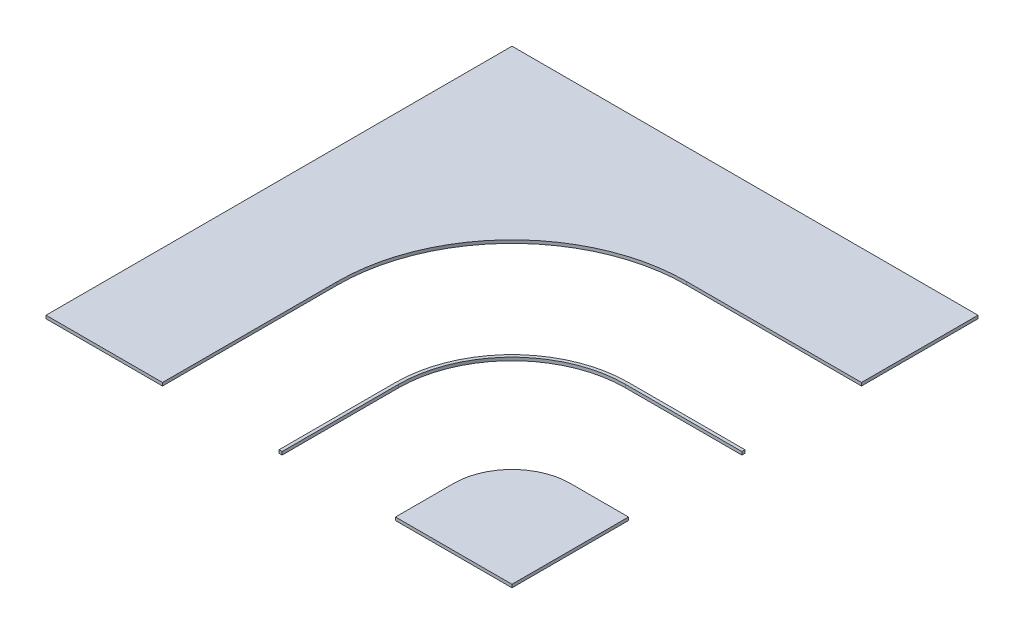
from build123d import *

# Parameters (mm, degrees)
BOSS_EXTRUDE1_DEPTH   = 10
BOSS_EXTRUDE1_2_DEPTH = 10
EXTRUDE_THIN1_DEPTH   = 10


with BuildPart() as part:
    # Sketch1 → Boss-Extrude1 (new body)
    with BuildSketch(Plane(origin=(0, 0, 0), x_dir=(1, 0, 0), z_dir=(0, 1, 0))):
        with BuildLine():
            Line((-750, 750), (-750, -750))
            Line((-750, -750), (-375.000000001, -750))
            Line((-375.000000001, -750), (-375.000000001, -187.5))
            ThreePointArc((-375.000000001, -187.5), (-210.247564418, 210.247564417), (187.5, 375))
            Line((187.5, 375), (375, 375))
            Line((375, 375.000000001), (379.917780163, 375.000000001))
            Line((379.917780163, 375), (750, 375))
            Line((750, 375), (750, 750))
            Line((750, 750), (-750, 750))
        make_face()
    extrude(amount=BOSS_EXTRUDE1_DEPTH)


with BuildPart() as body_2:
    # Sketch1 → Boss-Extrude1 2 (new body)
    with BuildSketch(Plane(origin=(0, 0, 0), x_dir=(1, 0, 0), z_dir=(0, 1, 0))):
        with BuildLine():
            Line((374.999999999, -562.5), (374.999999999, -750))
            Line((374.999999999, -750), (750, -750))
            Line((750, -750), (750, -375))
            Line((750, -375), (562.5, -375))
            ThreePointArc((562.5, -375), (429.917478527, -429.917478528), (374.999999999, -562.5))
        make_face()
    extrude(amount=BOSS_EXTRUDE1_2_DEPTH)


with BuildPart() as body_3:
    # Sketch2 → Extrude-Thin1 (new body)
    with BuildSketch(Plane(origin=(0, 0, 0), x_dir=(1, 0, 0), z_dir=(0, 1, 0))):
        with BuildLine():
            Line((0, -750), (0, -375))
            ThreePointArc((0, -375), (109.834957055, -109.834957055), (375, 0))
            Line((375, 0), (750, 0))
            Line((750, 0), (750, -10))
            Line((750, -10), (375, -10))
            ThreePointArc((375, -10), (116.906024867, -116.906024867), (10, -375))
            Line((10, -375), (10, -750))
            Line((10, -750), (0, -750))
        make_face()
    extrude(amount=EXTRUDE_THIN1_DEPTH)


solid = Compound([part.part, body_2.part, body_3.part])
